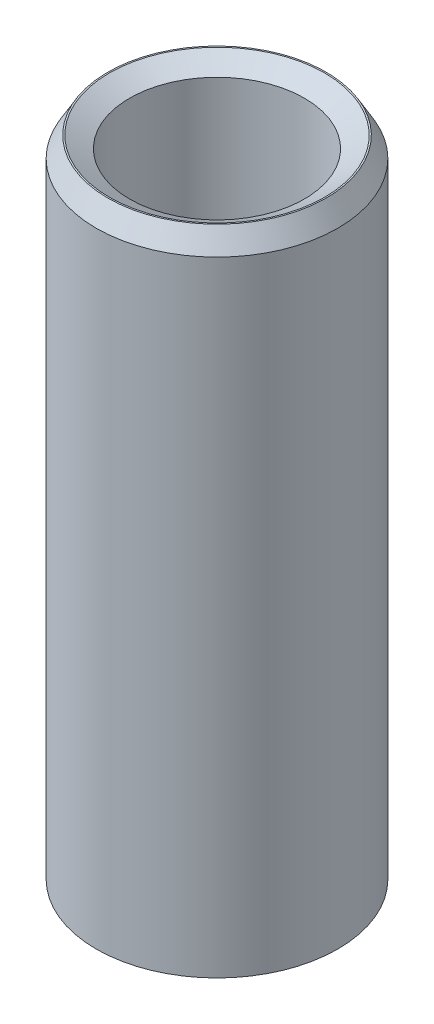
from build123d import *
from OCP.BRepFilletAPI import BRepFilletAPI_MakeChamfer

# Parameters (mm, degrees)
SKETCH1_R           = 12.5
BOSS_EXTRUDE1_DEPTH = 67.888815627
SKETCH2_R           = 9.043663229
CUT_EXTRUDE1_DEPTH  = 71.152628513
CHAMFER1_SIZE       = 2.093938291
CHAMFER1_SIZE2      = 1.208935836


with BuildPart() as part:
    # Sketch1 → Boss-Extrude1 (new body)
    with BuildSketch(Plane(origin=(0, 0, 0), x_dir=(1, 0, 0), z_dir=(0, 1, 0))):
        Circle(SKETCH1_R)
    extrude(amount=BOSS_EXTRUDE1_DEPTH)

    # Sketch2 → Cut-Extrude1 (cut, through all)
    with BuildSketch(Plane(origin=(0, 0, 0), x_dir=(1, 0, 0), z_dir=(0, 1, 0))):
        Circle(SKETCH2_R)
    extrude(amount=CUT_EXTRUDE1_DEPTH, mode=Mode.SUBTRACT)

    # Chamfer1: one chamfer whose edges measure the first distance from different faces: ONE call of the kernel's chamfer builder (chamfer() names one face for all edges)
    chamfer1_edges_1 = [part.edges().sort_by_distance(p)[0] for p in [
        (-9.043663229, 67.888815627, 0),
    ]]
    chamfer1_side_1 = [part.faces().sort_by_distance(p)[0] for p in [
        (-12.146446609, 67.888815627, 0),
    ]]
    chamfer1_edges_2 = [part.edges().sort_by_distance(p)[0] for p in [
        (-9.043663229, 0, 0),
    ]]
    chamfer1_side_2 = [part.faces().sort_by_distance(p)[0] for p in [
        (-9.043663229, 33.944407814, 0),
    ]]
    chamfer1_edges_3 = [part.edges().sort_by_distance(p)[0] for p in [
        (-12.5, 0, 0),
    ]]
    chamfer1_side_3 = [part.faces().sort_by_distance(p)[0] for p in [
        (-12.146446609, 0, 0),
    ]]
    chamfer1_edges_4 = [part.edges().sort_by_distance(p)[0] for p in [
        (-12.5, 67.888815627, 0),
    ]]
    chamfer1_side_4 = [part.faces().sort_by_distance(p)[0] for p in [
        (-12.5, 33.944407814, 0),
    ]]
    chamfer1 = BRepFilletAPI_MakeChamfer(part.part.solid().wrapped)
    for e in chamfer1_edges_1:
        chamfer1.Add(CHAMFER1_SIZE, CHAMFER1_SIZE2, e.wrapped, chamfer1_side_1[0].wrapped)  # the first distance lies on this face
    for e in chamfer1_edges_2:
        chamfer1.Add(CHAMFER1_SIZE, CHAMFER1_SIZE2, e.wrapped, chamfer1_side_2[0].wrapped)  # the first distance lies on this face
    for e in chamfer1_edges_3:
        chamfer1.Add(CHAMFER1_SIZE, CHAMFER1_SIZE2, e.wrapped, chamfer1_side_3[0].wrapped)  # the first distance lies on this face
    for e in chamfer1_edges_4:
        chamfer1.Add(CHAMFER1_SIZE, CHAMFER1_SIZE2, e.wrapped, chamfer1_side_4[0].wrapped)  # the first distance lies on this face
    add(Compound.cast(chamfer1.Shape()), mode=Mode.REPLACE)


solid = part.part
